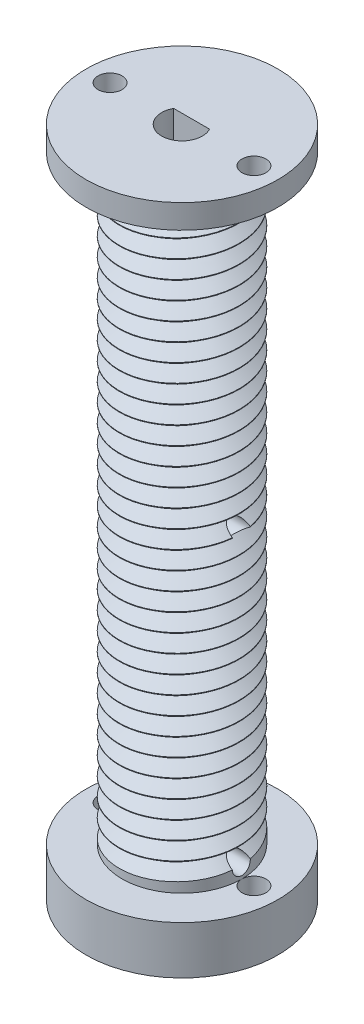
from build123d import *

# Parameters (mm, degrees)
ESBO_O2_2_R                = 5
RESSALTO_EXTRUS_O2_DEPTH   = 25
VARREDURA_DE_CORTE1_PITCH  = 1.5
ESBO_O8_R                  = 8
ESBO_O8_R_2                = 1
RESSALTO_EXTRUS_O3_DEPTH   = 2
VARREDURA_DE_CORTE6_PITCH  = 1.5
RESSALTO_EXTRUS_O5_START   = -54
ESBO_O8_3_R                = 8
ESBO_O8_3_R_2              = 1
RESSALTO_EXTRUS_O5_DEPTH   = 4
CORTE_EXTRUS_O1_DEPTH      = 32.128764833
CORTE_EXTRUS_O1_DEPTH_BACK = 32.128764833
ESBO_O49_R                 = 0.8
CORTE_EXTRUS_O2_DEPTH      = 32.128764833
CORTE_EXTRUS_O3_START      = -4
ESBO_O49_3_R               = 1.3
ESBO_O49_3_R_2             = 0.8
CORTE_EXTRUS_O3_DEPTH      = 12
CORTE_EXTRUS_O4_DEPTH      = 32.128764977
CORTE_EXTRUS_O4_DEPTH_BACK = 32.128764977
ESBO_O103_R                = 0.75


with BuildPart() as part:
    # Esboço2<2> → Ressalto-extrusão2 (new, symmetric)
    with BuildSketch(Plane(origin=(0, 0, 0), x_dir=(1, 0, 0), z_dir=(0, 1, 0))):
        with Locations(Location((0, 0, 0), (0, 0, 270))):
            Circle(ESBO_O2_2_R)
    extrude(amount=RESSALTO_EXTRUS_O2_DEPTH, both=True)

    # Varredura de corte1: the profile of Esboço101 profile screwed along a right-hand helix of 16 turns, 8 arcs to a turn; built about Z, then put on its axis
    varredura_de_corte1_z = Axis((0, 0, 0), (0, 0, 1))
    varredura_de_corte1_corners = [(5.0003, 0, 0.7252175), (4, 0, 0), (5.0003, 0, -0.7252175)]
    with BuildLine(mode=Mode.PRIVATE) as varredura_de_corte1_profile:
        Line(varredura_de_corte1_corners[0], varredura_de_corte1_corners[1])
        Line(varredura_de_corte1_corners[1], varredura_de_corte1_corners[2])
        Line(varredura_de_corte1_corners[2], varredura_de_corte1_corners[0])
    varredura_de_corte1_cap = Face(varredura_de_corte1_profile.wire())
    varredura_de_corte1_turn_angles = [0, 22.5, 45, 67.5, 90, 112.5, 135, 157.5, 180, 202.5, 225, 247.5, 270, 292.5, 315, 337.5, 360]
    varredura_de_corte1_turn_weights = [1, 0.9238795325112867, 1, 0.9238795325112867, 1, 0.9238795325112867, 1, 0.9238795325112867, 1, 0.9238795325112867, 1, 0.9238795325112867, 1, 0.9238795325112867, 1, 0.9238795325112867, 1]
    varredura_de_corte1_turn_rails = [Edge.make_bspline([Vector(p[0], p[1], 0).rotate(varredura_de_corte1_z, varredura_de_corte1_turn_angles[k]) / varredura_de_corte1_turn_weights[k] + Vector(0, 0, p[2] + VARREDURA_DE_CORTE1_PITCH * varredura_de_corte1_turn_angles[k] / 360) for k in range(17)], [0, 0, 0, 1, 1, 2, 2, 3, 3, 4, 4, 5, 5, 6, 6, 7, 7, 8, 8, 8], 2, varredura_de_corte1_turn_weights) for p in varredura_de_corte1_corners]
    varredura_de_corte1_turn_sides = [Face.make_surface_from_curves(varredura_de_corte1_turn_rails[p[0]], varredura_de_corte1_turn_rails[p[1]]) for p in [(0, 1), (1, 2), (2, 0)]]
    varredura_de_corte1 = Plane(origin=(0, 0, 0), x_dir=(-1, 0, 0), z_dir=(0, 1, 0)) * Solid(Shell([*[p.moved(Location((0, 0, VARREDURA_DE_CORTE1_PITCH * i))) for i in range(16) for p in varredura_de_corte1_turn_sides], varredura_de_corte1_cap, varredura_de_corte1_cap.rotate(varredura_de_corte1_z, 5760).moved(Location((0, 0, VARREDURA_DE_CORTE1_PITCH * 5760 / 360)))]))
    add(varredura_de_corte1, mode=Mode.SUBTRACT)

    # Esboço8 → Ressalto-extrusão3 (add)
    with BuildSketch(Plane(origin=(0, 25, 0), x_dir=(1, 0, 0), z_dir=(0, 1, 0))):
        with Locations(Location((0, 0, 0), (0, 0, 270))):
            Circle(ESBO_O8_R)
        with Locations(Location((6, 0, 0), (0, 0, 179.999260319))):
            Circle(ESBO_O8_R_2, mode=Mode.SUBTRACT)
        with Locations(Location((-6, 0, 0), (0, 0, 90))):
            Circle(ESBO_O8_R_2, mode=Mode.SUBTRACT)
    extrude(amount=RESSALTO_EXTRUS_O3_DEPTH)

    # Varredura de corte6: the profile of Esboço101<2> profile screwed along a right-hand helix of 16 turns, 8 arcs to a turn; built about Z, then put on its axis
    varredura_de_corte6_z = Axis((0, 0, 0), (0, 0, 1))
    varredura_de_corte6_corners = [(5.0003, 0, -0.7252175), (4, 0, 0), (5.0003, 0, 0.7252175)]
    with BuildLine(mode=Mode.PRIVATE) as varredura_de_corte6_profile:
        Line(varredura_de_corte6_corners[0], varredura_de_corte6_corners[1])
        Line(varredura_de_corte6_corners[1], varredura_de_corte6_corners[2])
        Line(varredura_de_corte6_corners[2], varredura_de_corte6_corners[0])
    varredura_de_corte6_cap = Face(varredura_de_corte6_profile.wire())
    varredura_de_corte6_turn_angles = [0, 22.5, 45, 67.5, 90, 112.5, 135, 157.5, 180, 202.5, 225, 247.5, 270, 292.5, 315, 337.5, 360]
    varredura_de_corte6_turn_weights = [1, 0.9238795325112867, 1, 0.9238795325112867, 1, 0.9238795325112867, 1, 0.9238795325112867, 1, 0.9238795325112867, 1, 0.9238795325112867, 1, 0.9238795325112867, 1, 0.9238795325112867, 1]
    varredura_de_corte6_turn_rails = [Edge.make_bspline([Vector(p[0], p[1], 0).rotate(varredura_de_corte6_z, varredura_de_corte6_turn_angles[k]) / varredura_de_corte6_turn_weights[k] + Vector(0, 0, p[2] + VARREDURA_DE_CORTE6_PITCH * varredura_de_corte6_turn_angles[k] / 360) for k in range(17)], [0, 0, 0, 1, 1, 2, 2, 3, 3, 4, 4, 5, 5, 6, 6, 7, 7, 8, 8, 8], 2, varredura_de_corte6_turn_weights) for p in varredura_de_corte6_corners]
    varredura_de_corte6_turn_sides = [Face.make_surface_from_curves(varredura_de_corte6_turn_rails[p[0]], varredura_de_corte6_turn_rails[p[1]]) for p in [(0, 1), (1, 2), (2, 0)]]
    varredura_de_corte6 = Plane(origin=(0, 0, 0), x_dir=(-1, 0, 0), z_dir=(0, -1, 0)) * Solid(Shell([*[p.moved(Location((0, 0, VARREDURA_DE_CORTE6_PITCH * i))) for i in range(16) for p in varredura_de_corte6_turn_sides], varredura_de_corte6_cap, varredura_de_corte6_cap.rotate(varredura_de_corte6_z, 5760).moved(Location((0, 0, VARREDURA_DE_CORTE6_PITCH * 5760 / 360)))]))
    add(varredura_de_corte6, mode=Mode.SUBTRACT)

    # Esboço8<3> → Ressalto-extrusão5 (add)
    with BuildSketch(Plane(origin=(0, 25, 0), x_dir=(1, 0, 0), z_dir=(0, 1, 0)).offset(RESSALTO_EXTRUS_O5_START)):
        with Locations(Location((0, 0, 0), (0, 0, 270))):
            Circle(ESBO_O8_3_R)
        with Locations(Location((6, 0, 0), (0, 0, 179.999260319))):
            Circle(ESBO_O8_3_R_2, mode=Mode.SUBTRACT)
        with Locations(Location((-6, 0, 0), (0, 0, 90))):
            Circle(ESBO_O8_3_R_2, mode=Mode.SUBTRACT)
    extrude(amount=RESSALTO_EXTRUS_O5_DEPTH)

    # Esboço48 → Corte-extrusão1 (cut, two sides: drawn at the far end of the back side and taken through both)
    with BuildSketch(Plane(origin=(0, 0, 0), x_dir=(1, 0, 0), z_dir=(0, 1, 0)).offset(-CORTE_EXTRUS_O1_DEPTH_BACK)):
        with BuildLine():
            Line((-1.5, 0.8), (1.5, 0.8))
            ThreePointArc((1.5, 0.8), (0, -1.7), (-1.5, 0.8))
        make_face()
    extrude(amount=CORTE_EXTRUS_O1_DEPTH + CORTE_EXTRUS_O1_DEPTH_BACK, mode=Mode.SUBTRACT)

    # Esboço49 → Corte-extrusão2 (cut, through all)
    with BuildSketch(Plane.XY):
        with Locations(Location((0, -27, 0), (0, 0, 90))):
            Circle(ESBO_O49_R)
    extrude(amount=-CORTE_EXTRUS_O2_DEPTH, mode=Mode.SUBTRACT)

    # Esboço49<3> → Corte-extrusão3 (cut)
    with BuildSketch(Plane.XY.offset(CORTE_EXTRUS_O3_START)):
        with Locations((0, -27)):
            Circle(ESBO_O49_3_R)
        with Locations(Location((0, -27, 0), (0, 0, 180))):
            Circle(ESBO_O49_3_R_2, mode=Mode.SUBTRACT)
    extrude(amount=-CORTE_EXTRUS_O3_DEPTH, mode=Mode.SUBTRACT)

    # Esboço103 → Corte-extrusão4 (cut, two sides: drawn at the far end of the back side and taken through both)
    with BuildSketch(Plane(origin=(0, 0, 0), x_dir=(0, 0, -1), z_dir=(1, 0, 0)).offset(-CORTE_EXTRUS_O4_DEPTH_BACK)):
        Circle(ESBO_O103_R)
        with Locations(Location((0.242679436, 23.98609574, 0), (0, 0, 2.725555606))):
            Circle(ESBO_O103_R)
        with Locations((0, -24)):
            Circle(ESBO_O103_R)
    extrude(amount=CORTE_EXTRUS_O4_DEPTH + CORTE_EXTRUS_O4_DEPTH_BACK, mode=Mode.SUBTRACT)


solid = part.part
